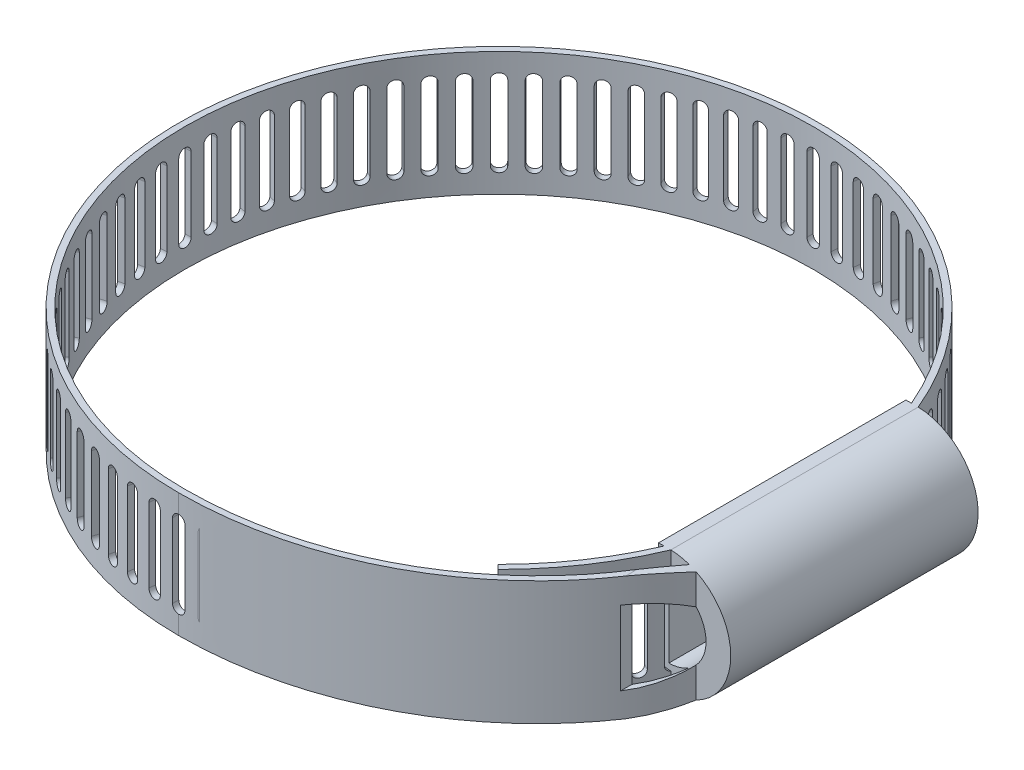
from build123d import *

# Parameters (mm, degrees)
EXTRUDE_THIN1_START      = -5
EXTRUDE_THIN1_DEPTH      = 10
CUT_EXTRUDE1_DEPTH       = 10
CIRPATTERN1_COUNT        = 80
BOSS_EXTRUDE1_DEPTH      = 7
BOSS_EXTRUDE1_DEPTH_BACK = 3
SKETCH3_W                = 20
SKETCH3_H                = 10
CUT_EXTRUDE2_REACH       = 50.951


# Read off the part's stored shape, not the designer's step: Extrude-Thin1
with BuildPart() as part:
    # Extrude-Thin1 outline → Extrude-Thin1 (new body)
    with BuildSketch(Plane(origin=(0, 0, 0), x_dir=(1, 0, 0), z_dir=(0, 1, 0)).offset(EXTRUDE_THIN1_START)):
        with BuildLine():
            ThreePointArc((18.273711835, -18.354330709), (-9.885161472, 23.939373064), (0, -25.9))
            add(Edge.make_bspline(
                [(0, -25.9), (1.837796246, -25.9), (3.675549686, -25.733555378), (7.281040469, -25.074014268), (9.048693617, -24.580931753), (12.446437437, -23.2866446), (14.076447867, -22.485467205), (17.136391147, -20.605190967), (18.56624953, -19.526131727), (21.1707319, -17.130957464), (22.34528846, -15.814894137), (24.393501966, -12.995872994), (25.26710041, -11.492979899), (26.679122129, -8.358014465), (27.217500077, -6.726020922), (27.937772015, -3.395973612), (28.119640546, -1.698010783), (28.119640546, 0)],
                knots=[0, 0, 0, 0, 0.125, 0.125, 0.25, 0.25, 0.375, 0.375, 0.5, 0.5, 0.625, 0.625, 0.75, 0.75, 0.875, 0.875, 1, 1, 1, 1], degree=3))
            Line((28.119640546, 0), (27.619640546, 0))
            add(Edge.make_bspline(
                [(0, -25.4), (27.619640546, -25.4), (27.619640546, 0)],
                knots=[4.71238898, 4.71238898, 4.71238898, 6.283185307, 6.283185307, 6.283185307], degree=2, weights=[1, 0.707106781, 1]))
            ThreePointArc((0, -25.4), (-9.694328239, 23.477223004), (17.920937475, -18))
            Line((17.920937475, -18), (18.273711835, -18.354330709))
        make_face()
    extrude(amount=EXTRUDE_THIN1_DEPTH)

    # Sketch2 → Cut-Extrude1 (cut)
    with BuildSketch(Plane(origin=(0, 0, -25.9), x_dir=(-1, 0, 0), z_dir=(0, 0, -1))):
        with BuildLine():
            Line((-0.5, -3), (-0.5, 3))
            ThreePointArc((-0.5, 3), (0, 3.5), (0.5, 3))
            Line((0.5, 3), (0.5, -3))
            ThreePointArc((0.5, -3), (0, -3.5), (-0.5, -3))
        make_face()
    cut_extrude1 = extrude(amount=-CUT_EXTRUDE1_DEPTH, mode=Mode.SUBTRACT)

    # CirPattern1: Cut-Extrude1 ×80 about axis
    cirpattern1_axis = Axis((0, 0, 0), (0, 1, 0))
    for i in range(1, CIRPATTERN1_COUNT):
        add(cut_extrude1.rotate(cirpattern1_axis, i * 360 / CIRPATTERN1_COUNT), mode=Mode.SUBTRACT)

    # Sketch3 → Boss-Extrude1 (add, two sides: drawn at the far end of the back side and taken through both)
    with BuildSketch(Plane(origin=(25.9, 0, 0), x_dir=(0, 0, -1), z_dir=(1, 0, 0)).offset(-BOSS_EXTRUDE1_DEPTH_BACK)):
        Rectangle(SKETCH3_W, SKETCH3_H)
    extrude(amount=BOSS_EXTRUDE1_DEPTH + BOSS_EXTRUDE1_DEPTH_BACK)

    # Sketch5 → Cut-Extrude2 (cut, up to next)
    with BuildSketch(Plane(origin=(0, 0, -10), x_dir=(-1, 0, 0), z_dir=(0, 0, -1)), mode=Mode.PRIVATE) as cut_extrude2_sk1:
        with BuildLine():
            Line((-23.891630334, 5), (-32.9, 5))
            Line((-32.9, 5), (-32.9, -5))
            Line((-32.9, -5), (-23.891630334, -5))
            ThreePointArc((-23.891630334, -5), (-28.735204801, 0), (-23.891630334, 5))
        make_face()
    cut_extrude2_tool1 = extrude(cut_extrude2_sk1.sketch, amount=-CUT_EXTRUDE2_REACH, mode=Mode.PRIVATE) & part.part
    # Sketch5 → Cut-Extrude2 (cut, up to next)
    with BuildSketch(Plane(origin=(0, 0, -10), x_dir=(-1, 0, 0), z_dir=(0, 0, -1)), mode=Mode.PRIVATE) as cut_extrude2_sk2:
        with BuildLine():
            Line((-23.732678882, 3.002525918), (-23.732678882, -3.002525918))
            ThreePointArc((-23.732678882, -3.002525918), (-26.735204801, 0), (-23.732678882, 3.002525918))
        make_face()
    cut_extrude2_tool2 = extrude(cut_extrude2_sk2.sketch, amount=-CUT_EXTRUDE2_REACH, mode=Mode.PRIVATE) & part.part
    add(cut_extrude2_tool1.solids().sort_by_distance((30.163399, 0, -10))[0], mode=Mode.SUBTRACT)
    add(cut_extrude2_tool2.solids().sort_by_distance((25.00699, 0, -10))[0], mode=Mode.SUBTRACT)


solid = part.part
